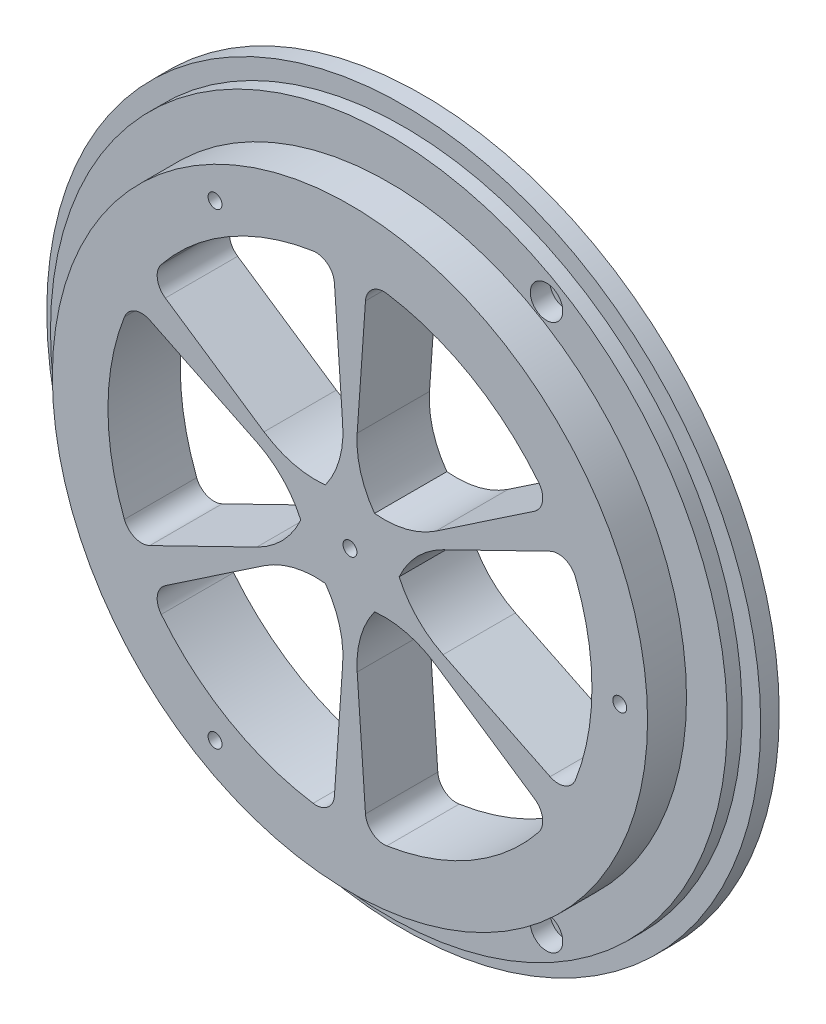
from build123d import *

# Parameters (mm, degrees)
SKETCH_1_R                       = 32.1
EXTRUDE_1_DEPTH                  = 5
EXTRUDE_START                    = 0.8
SKETCH_2_R                       = 36.5
EXTRUDE_2_DEPTH                  = 1.6
SKETCH_3_R                       = 38.5
EXTRUDE_3_DEPTH                  = 2
SKETCH_4_R                       = 26.1
CUT_EXTRUDE_1_DEPTH              = 56.003090822
SKETCH_4_3_R                     = 5
EXTRUDE_4_DEPTH                  = 7.8
EXTRUDE_5_DEPTH                  = 7.8
FILLET_6_R                       = 2
PATTERN_CIRCULAR_2_COUNT         = 6
FILLET_6_OF_PATTERN_CIRCULAR_2_R = 2
FILLET_7_R                       = 10
SKETCH_6_R                       = 0.75
CUT_EXTRUDE_2_DEPTH              = 3
SKETCH_8_R                       = 1
CUT_EXTRUDE_4_DEPTH              = 55.608973622
SKETCH_8_3_R                     = 1.75
CUT_EXTRUDE_5_DEPTH              = 2.1


with BuildPart() as part:
    # 草图1 → 凸台-拉伸1 (new body)
    with BuildSketch(Plane.XY):
        Circle(SKETCH_1_R)
    extrude(amount=EXTRUDE_1_DEPTH)

    # 草图2 → 凸台-拉伸2 (add)
    with BuildSketch(Plane(origin=(0, 0, 0), x_dir=(-1, 0, 0), z_dir=(0, 0, -1)).offset(EXTRUDE_START)):
        Circle(SKETCH_2_R)
    extrude(amount=-EXTRUDE_2_DEPTH)

    # 草图3 → 凸台-拉伸3 (add)
    with BuildSketch(Plane(origin=(0, 0, -0.8), x_dir=(-1, 0, 0), z_dir=(0, 0, -1))):
        Circle(SKETCH_3_R)
    extrude(amount=EXTRUDE_3_DEPTH)

    # 草图4 → 切除-拉伸1 (cut, through all)
    with BuildSketch(Plane.XY.offset(5)):
        Circle(SKETCH_4_R)
    extrude(amount=-CUT_EXTRUDE_1_DEPTH, mode=Mode.SUBTRACT)



with BuildPart() as body_2:
    # 草图4<3> → 凸台-拉伸4 (new, through all)
    with BuildSketch(Plane.XY.offset(5)):
        Circle(SKETCH_4_3_R)
    extrude(amount=-EXTRUDE_4_DEPTH)


with BuildPart() as part_1:
    add(part.part)

    add(body_2.part)  # 凸台-拉伸5 merges body 2
    # 草图4<4> → 凸台-拉伸5 (add, through all)
    with BuildSketch(Plane.XY.offset(5)):
        with BuildLine():
            Line((-1.820643965, 26.036421712), (-0.348782369, 4.987820251))
            ThreePointArc((-0.348782369, 4.987820251), (0, 5), (0.348782369, 4.987820251))
            Line((0.348782369, 4.987820251), (1.820643965, 26.036421712))
            ThreePointArc((1.820643965, 26.036421712), (0, 26.1), (-1.820643965, 26.036421712))
        make_face()
    extrude_5 = extrude(amount=-EXTRUDE_5_DEPTH)

    # 圆角6
    fillet_6_edges = [part_1.edges().sort_by_distance(p)[0] for p in [
        (1.820643965, 26.036421712, 1.1),
        (-1.820643965, 26.036421712, 1.1),
    ]]
    fillet(fillet_6_edges, radius=FILLET_6_R)

    # 阵列(圆周)2: 凸台-拉伸5 ×6 about axis
    pattern_circular_2_axis = Axis((0, 0, 0), (0, 0, 1))
    for i in range(1, PATTERN_CIRCULAR_2_COUNT):
        add(extrude_5.rotate(pattern_circular_2_axis, i * 360 / PATTERN_CIRCULAR_2_COUNT))

    # 圆角6 of 阵列(圆周)2
    fillet_6_of_pattern_circular_2_edges = [part_1.edges().sort_by_distance(p)[0] for p in [
        (-21.637880644, 14.594934781, 1.1),
        (-23.458524608, 11.441486931, 1.1),
        (-23.458524608, -11.441486931, 1.1),
        (-21.637880644, -14.594934781, 1.1),
        (-1.820643965, -26.036421712, 1.1),
        (1.820643965, -26.036421712, 1.1),
        (21.637880644, -14.594934781, 1.1),
        (23.458524608, -11.441486931, 1.1),
        (23.458524608, 11.441486931, 1.1),
        (21.637880644, 14.594934781, 1.1),
    ]]
    fillet(fillet_6_of_pattern_circular_2_edges, radius=FILLET_6_OF_PATTERN_CIRCULAR_2_R)

    # 圆角7
    # the kernel refuses this fillet: 10 mm, written as the material it adds along each edge
    with BuildSketch(Plane(origin=(-4.493970231, -2.191855734, 5), x_dir=(-0.8987940462991628, -0.4383711467890857, 0), z_dir=(0, 0, -1)), Plane(origin=(-0.348782369, -4.987820251, 5), x_dir=(-0.06975647374411581, -0.9975640502598249, 0), z_dir=(0, 0, -1)), Plane(origin=(4.145187863, -2.795964517, 5), x_dir=(0.8290375725550467, -0.5591929034707394, 0), z_dir=(0, 0, -1)), Plane(origin=(4.493970231, 2.191855734, 5), x_dir=(0.8987940462991627, 0.43837114678908606, 0), z_dir=(0, 0, -1)), Plane(origin=(0.348782369, 4.987820251, 5), x_dir=(0.0697564737441158, 0.9975640502598249, 0), z_dir=(0, 0, -1)), Plane(origin=(-4.145187863, 2.795964517, 5), x_dir=(-0.8290375725550471, 0.5591929034707388, 0), z_dir=(0, 0, -1))) as fillet_7_piece_1:
        with BuildLine():
            CenterArc((6.180339887, 10), FILLET_7_R, 221.810314896, 48.189685104)
            ThreePointArc((-1.273220038, 3.333333333), (-0.329138205, 1.784110449), (0, 0))
            Line((0, 0), (6.180339887, 0))
        make_face()
    extrude(amount=7.8)
    with BuildSketch(Plane(origin=(-4.145187863, -2.795964517, 5), x_dir=(-0.8290375725550488, -0.5591929034707364, 0), z_dir=(0, 0, -1)), Plane(origin=(0.348782369, -4.987820251, 5), x_dir=(0.06975647374411298, -0.9975640502598251, 0), z_dir=(0, 0, -1)), Plane(origin=(4.493970231, -2.191855734, 5), x_dir=(0.8987940462991613, -0.4383711467890891, 0), z_dir=(0, 0, -1)), Plane(origin=(4.145187863, 2.795964517, 5), x_dir=(0.8290375725550484, 0.5591929034707368, 0), z_dir=(0, 0, -1)), Plane(origin=(-0.348782369, 4.987820251, 5), x_dir=(-0.0697564737441132, 0.9975640502598251, 0), z_dir=(0, 0, -1)), Plane(origin=(-4.493970231, 2.191855734, 5), x_dir=(-0.8987940462991615, 0.43837114678908873, 0), z_dir=(0, 0, -1))) as fillet_7_piece_2:
        with BuildLine():
            CenterArc((6.180339887, -10), FILLET_7_R, 90, 48.189685104)
            ThreePointArc((-1.273220038, -3.333333333), (-0.329138205, -1.784110449), (0, 0))
            Line((0, 0), (6.180339887, 0))
        make_face()
    extrude(amount=7.8)

    # 草图6 → 切除-拉伸2 (cut)
    with BuildSketch(Plane.XY.offset(5)):
        Circle(SKETCH_6_R)
        with Locations((-14.55, 25.20133925)):
            Circle(SKETCH_6_R)
        with Locations((29.1, 0)):
            Circle(SKETCH_6_R)
        with Locations((-14.55, -25.20133925)):
            Circle(SKETCH_6_R)
    extrude(amount=-CUT_EXTRUDE_2_DEPTH, mode=Mode.SUBTRACT)

    # 草图8 → 切除-拉伸4 (cut, through all)
    with BuildSketch(Plane.XY.offset(0.8)):
        with Locations((17, 29.444863729)):
            Circle(SKETCH_8_R)
        with Locations((-34, 0)):
            Circle(SKETCH_8_R)
        with Locations((17, -29.444863729)):
            Circle(SKETCH_8_R)
    extrude(amount=-CUT_EXTRUDE_4_DEPTH, mode=Mode.SUBTRACT)

    # 草图8<3> → 切除-拉伸5 (cut)
    with BuildSketch(Plane.XY.offset(0.8)):
        with Locations((-34, 0)):
            Circle(SKETCH_8_3_R)
        with Locations((17, 29.444863729)):
            Circle(SKETCH_8_3_R)
        with Locations((17, -29.444863729)):
            Circle(SKETCH_8_3_R)
    extrude(amount=-CUT_EXTRUDE_5_DEPTH, mode=Mode.SUBTRACT)


solid = part_1.part
